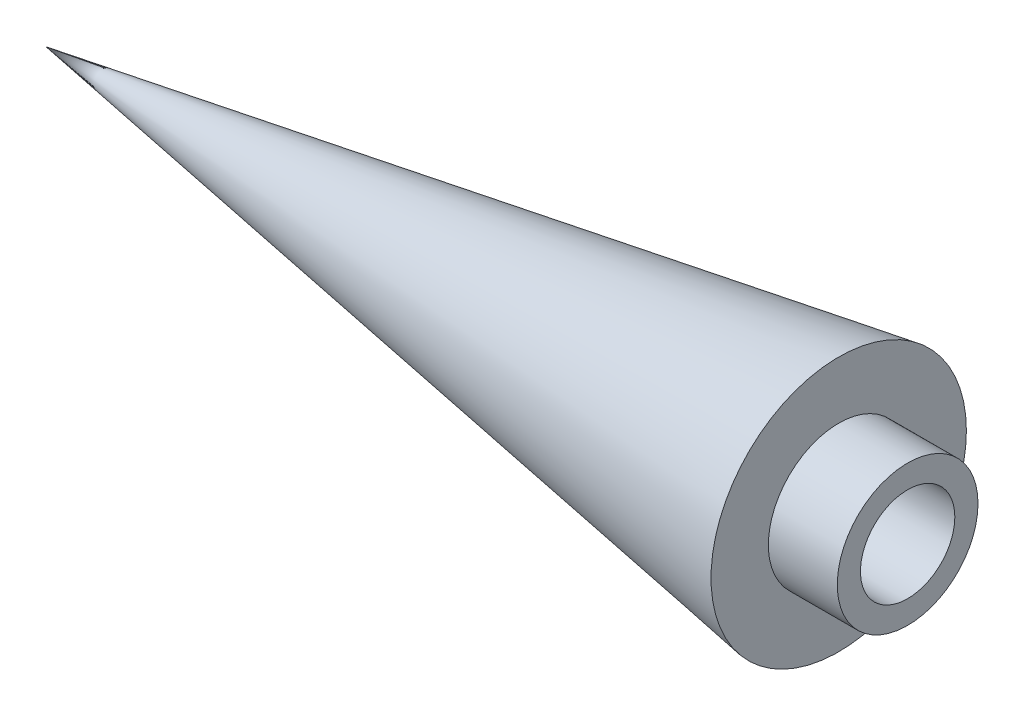
from build123d import *

# Parameters (mm, degrees)
SKETCH2_R           = 3
CUT_EXTRUDE1_DEPTH  = 50
SKETCH3_R           = 10.20806569
SKETCH3_R_2         = 6.845384661
BOSS_EXTRUDE1_DEPTH = 10


with BuildPart() as part:
    # Sketch1 → Revolve1 (revolve)
    with BuildSketch(Plane.XY):
        Polygon((0, 0), (0, 18.525), (-115, 0), align=None)
    revolve(axis=Axis((0, 0, 0), (-1, 0, 0)))

    # Sketch2 → Cut-Extrude1 (cut)
    with BuildSketch(Plane(origin=(0, 0, 0), x_dir=(0, 0, -1), z_dir=(1, 0, 0))):
        Circle(SKETCH2_R)
    extrude(amount=-CUT_EXTRUDE1_DEPTH, mode=Mode.SUBTRACT)

    # Sketch3 → Boss-Extrude1 (add)
    with BuildSketch(Plane(origin=(0, 0, 0), x_dir=(0, 0, -1), z_dir=(1, 0, 0))):
        Circle(SKETCH3_R)
        Circle(SKETCH3_R_2, mode=Mode.SUBTRACT)
    extrude(amount=BOSS_EXTRUDE1_DEPTH)


solid = part.part
